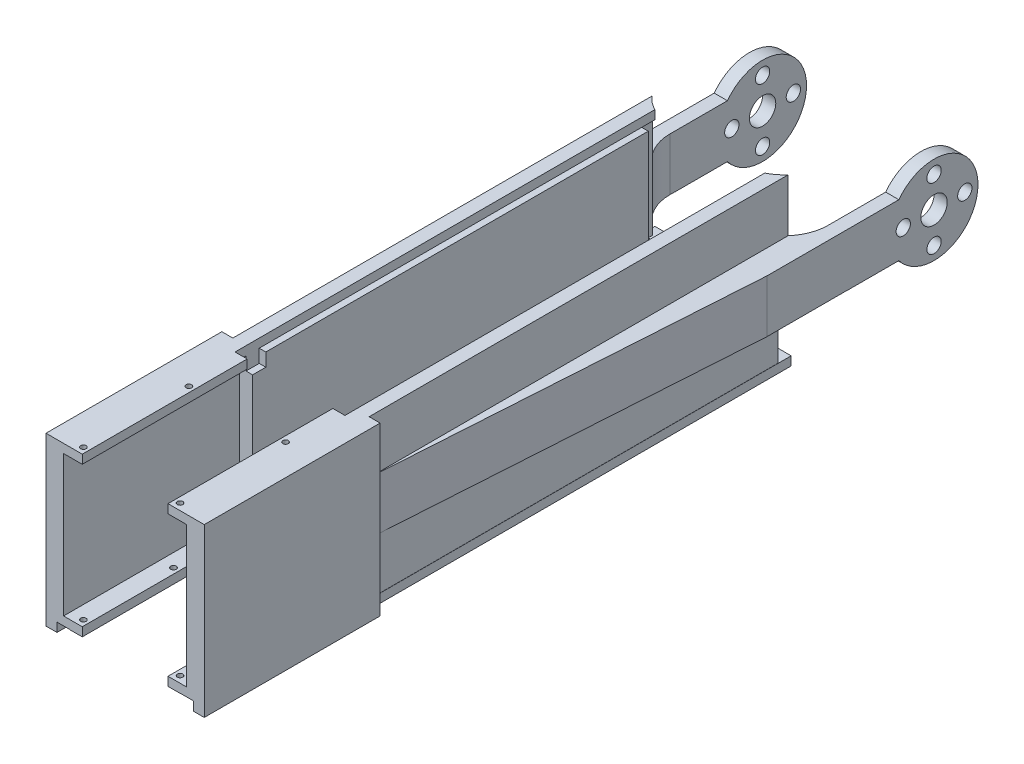
from build123d import *
from build123d.topology import SkipClean

# Parameters (mm, degrees)
BOSS_EXTRUDE1_DEPTH      = 3
SKETCH2_W                = 25
SKETCH2_H                = 2
BOSS_EXTRUDE2_DEPTH      = 130
SKETCH3_R                = 0.625
CUT_EXTRUDE1_DEPTH       = 3
SKETCH4_R                = 0.625
CUT_EXTRUDE2_DEPTH       = 3
SKETCH5_W                = 3
SKETCH5_H                = 25
BOSS_EXTRUDE3_DEPTH      = 40
SKETCH7_W                = 19.5
SKETCH7_H                = 75
CUT_EXTRUDE5_DEPTH       = 40
SKETCH10_W               = 25
SKETCH10_H               = 3
BOSS_EXTRUDE4_DEPTH      = 10
SKETCH11_W               = 25
SKETCH11_H               = 3
BOSS_EXTRUDE5_DEPTH      = 10
SKETCH12_W               = 3
SKETCH12_H               = 25
BOSS_EXTRUDE6_DEPTH      = 10
SKETCH13_W               = 3
SKETCH13_H               = 25
BOSS_EXTRUDE7_DEPTH      = 10
SKETCH14_W               = 133
SKETCH14_H               = 35.95813892
BOSS_EXTRUDE11_DEPTH     = 3
SKETCH15_W               = 133
SKETCH15_H               = 35.95813892
BOSS_EXTRUDE12_DEPTH     = 3
SKETCH16_W               = 23
SKETCH16_H               = 28
CUT_EXTRUDE6_DEPTH       = 13
CUT_EXTRUDE7_DEPTH       = 146.523194028
CUT_EXTRUDE7_DEPTH_BACK  = 146.523194028
SKETCH6_R                = 1.625
SKETCH6_R_2              = 3
FILLET1_R                = 10
FILLET2_R                = 10
SKETCH17_W               = 3
SKETCH17_H               = 2.5
CUT_EXTRUDE8_DEPTH       = 30
SKETCH19_W               = 28
SKETCH19_H               = 32
CUT_EXTRUDE9_DEPTH       = 40
CUT_EXTRUDE11_DEPTH      = 137.54669531
CUT_EXTRUDE11_DEPTH_BACK = 137.54669531
SKETCH20_W               = 25.25
SKETCH20_H               = 11.847644437
SKETCH20_W_2             = 25
SKETCH20_H_2             = 13.837487399
CUT_EXTRUDE12_DEPTH      = 144.934012659
CUT_EXTRUDE12_DEPTH_BACK = 144.934012659
CUT_EXTRUDE13_DEPTH      = 138.746143322
CUT_EXTRUDE13_DEPTH_BACK = 138.746143322
SKETCH22_W               = 10
SKETCH22_H               = 25
CUT_EXTRUDE14_DEPTH      = 10
CUT_EXTRUDE14_DEPTH_BACK = 10
SKETCH24_W               = 5.5
SKETCH24_H               = 6.5
SKETCH24_H_2             = 6.525307194
CUT_EXTRUDE15_DEPTH      = 176.197031938
CUT_EXTRUDE15_DEPTH_BACK = 176.197031938
SKETCH25_W               = 28
SKETCH25_H               = 32
SKETCH31_W               = 25
SKETCH31_H               = 90
CUT_EXTRUDE17_DEPTH      = 5
SKETCH32_W               = 31
SKETCH32_H               = 3
BOSS_EXTRUDE16_DEPTH     = 3
SKETCH33_W               = 5.5
SKETCH33_H               = 11.974692806
SKETCH33_W_2             = 3
SKETCH33_H_2             = 32
BOSS_EXTRUDE17_DEPTH     = 90
CUT_EXTRUDE18_DEPTH      = 137.769879725
CUT_EXTRUDE18_DEPTH_BACK = 137.769879725
FILLET3_START            = -5.974692806
FILLET3_DEPTH            = 11.974692806
FILLET3_START_2          = -10
FILLET3_2_DEPTH          = 28
FILLET3_START_3          = 16
FILLET3_3_DEPTH          = 2
FILLET4_START            = -5.974692806
FILLET4_DEPTH            = 11.974692806
FILLET4_START_2          = -10
FILLET4_2_DEPTH          = 28
FILLET4_START_3          = 16
FILLET4_3_DEPTH          = 2
SKETCH35_W               = 31
SKETCH35_H               = 98.5
BOSS_EXTRUDE18_DEPTH     = 2
SKETCH38_W               = 2.5
SKETCH38_H               = 38
BOSS_EXTRUDE22_DEPTH     = 40
CUT_EXTRUDE19_DEPTH      = 140.907112042
CUT_EXTRUDE19_DEPTH_BACK = 5
SKETCH39_W               = 25
SKETCH39_H               = 5.5


with BuildPart() as part:
    # Sketch1 → Boss-Extrude1 (new body)
    with BuildSketch(Plane.XY):
        Polygon((12.5, 12.5), (21, 12.5), (21, -12.5), (12.5, -12.5), (12.5, -18), (-12.5, -18), (-12.5, -12.5), (-21, -12.5), (-21, 12.5), (-12.5, 12.5), (-12.5, 18), (12.5, 18), align=None)
    extrude(amount=BOSS_EXTRUDE1_DEPTH)

    # Sketch2 → Boss-Extrude2 (add)
    with BuildSketch(Plane.XY.offset(3)):
        with Locations((0, 17)):
            Rectangle(SKETCH2_W, SKETCH2_H)
        with Locations((0, -17)):
            Rectangle(SKETCH2_W, SKETCH2_H)
    extrude(amount=BOSS_EXTRUDE2_DEPTH)

    # Sketch3 → Cut-Extrude1 (cut)
    with BuildSketch(Plane(origin=(0, 18, 0), x_dir=(1, 0, 0), z_dir=(0, 1, 0))):
        with Locations(Location((-11, -107.5, 0), (0, 0, 270))):
            Circle(SKETCH3_R)
        with Locations(Location((11, -107.5, 0), (0, 0, 270))):
            Circle(SKETCH3_R)
        with Locations(Location((-11, -131.5, 0), (0, 0, 270))):
            Circle(SKETCH3_R)
        with Locations(Location((11, -131.5, 0), (0, 0, 270))):
            Circle(SKETCH3_R)
    extrude(amount=-CUT_EXTRUDE1_DEPTH, mode=Mode.SUBTRACT)

    # Sketch4 → Cut-Extrude2 (cut)
    with BuildSketch(Plane(origin=(0, -16, 0), x_dir=(1, 0, 0), z_dir=(0, 1, 0))):
        with Locations(Location((-11, -131.5, 0), (0, 0, 270))):
            Circle(SKETCH4_R)
        with Locations(Location((11, -131.5, 0), (0, 0, 270))):
            Circle(SKETCH4_R)
        with Locations(Location((-11, -111, 0), (0, 0, 270))):
            Circle(SKETCH4_R)
        with Locations(Location((11, -111, 0), (0, 0, 270))):
            Circle(SKETCH4_R)
    extrude(amount=-CUT_EXTRUDE2_DEPTH, mode=Mode.SUBTRACT)

    # Sketch5 → Boss-Extrude3 (add)
    with BuildSketch(Plane(origin=(0, 0, 0), x_dir=(-1, 0, 0), z_dir=(0, 0, -1))):
        with Locations((-19.5, 0)):
            Rectangle(SKETCH5_W, SKETCH5_H)
        with Locations((19.5, 0)):
            Rectangle(SKETCH5_W, SKETCH5_H)
    extrude(amount=BOSS_EXTRUDE3_DEPTH)

    # Sketch7 → Cut-Extrude5 (cut)
    with BuildSketch(Plane(origin=(0, 18, 0), x_dir=(1, 0, 0), z_dir=(0, 1, 0))):
        with Locations((0, -133)):
            Rectangle(SKETCH7_W, SKETCH7_H)
    extrude(amount=-CUT_EXTRUDE5_DEPTH, mode=Mode.SUBTRACT)

    # Sketch10 → Boss-Extrude4 (add)
    with BuildSketch(Plane(origin=(0, 18, 0), x_dir=(1, 0, 0), z_dir=(0, 1, 0))):
        with Locations((0, -1.5)):
            Rectangle(SKETCH10_W, SKETCH10_H)
    extrude(amount=BOSS_EXTRUDE4_DEPTH)

    # Sketch11 → Boss-Extrude5 (add)
    with BuildSketch(Plane.XZ.offset(18)):
        with Locations((0, 1.5)):
            Rectangle(SKETCH11_W, SKETCH11_H)
    extrude(amount=BOSS_EXTRUDE5_DEPTH)

    # Sketch12 → Boss-Extrude6 (add)
    with BuildSketch(Plane.ZY.offset(21)):
        with Locations((1.5, 0)):
            Rectangle(SKETCH12_W, SKETCH12_H)
    extrude(amount=BOSS_EXTRUDE6_DEPTH)

    # Sketch13 → Boss-Extrude7 (add)
    with BuildSketch(Plane(origin=(21, 0, 0), x_dir=(0, 0, -1), z_dir=(1, 0, 0))):
        with Locations((-1.5, 0)):
            Rectangle(SKETCH13_W, SKETCH13_H)
    extrude(amount=BOSS_EXTRUDE7_DEPTH)

    # Sketch14 → Boss-Extrude11 (add)
    with BuildSketch(Plane.ZY.offset(12.5)):
        with Locations((66.5, 0.02093054)):
            Rectangle(SKETCH14_W, SKETCH14_H)
    extrude(amount=BOSS_EXTRUDE11_DEPTH)

    # Sketch15 → Boss-Extrude12 (add)
    with BuildSketch(Plane(origin=(12.5, 0, 0), x_dir=(0, 0, -1), z_dir=(1, 0, 0))):
        with Locations((-66.5, 0.02093054)):
            Rectangle(SKETCH15_W, SKETCH15_H)
    extrude(amount=BOSS_EXTRUDE12_DEPTH)

    # Sketch16 → Cut-Extrude6 (cut)
    with BuildSketch(Plane(origin=(0, 0, 0), x_dir=(-1, 0, 0), z_dir=(0, 0, -1))):
        Rectangle(SKETCH16_W, SKETCH16_H)
    extrude(amount=-CUT_EXTRUDE6_DEPTH, mode=Mode.SUBTRACT)

    # Sketch6 → Cut-Extrude7 (cut, two sides: drawn at the far end of the back side and taken through both)
    with BuildSketch(Plane(origin=(21, 0, 0), x_dir=(0, 0, -1), z_dir=(1, 0, 0)).offset(-CUT_EXTRUDE7_DEPTH_BACK)):
        with Locations(Location((30, 7, 0), (0, 0, 90))):
            Circle(SKETCH6_R)
        with Locations(Location((30, 0, 0), (0, 0, 90))):
            Circle(SKETCH6_R_2)
        with Locations(Location((37, 0, 0), (0, 0, 90))):
            Circle(SKETCH6_R)
        with Locations(Location((30, -7, 0), (0, 0, 90))):
            Circle(SKETCH6_R)
        with Locations(Location((23, 0, 0), (0, 0, 90))):
            Circle(SKETCH6_R)
        with BuildLine():
            Line((30, 10), (30, 12.5))
            Line((30, 12.5), (46.457343261, 12.5))
            Line((46.457343261, 12.5), (46.457343261, -12.5))
            Line((46.457343261, -12.5), (30, -12.5))
            Line((30, -12.5), (30, -10))
            ThreePointArc((30, -10), (40, 0), (30, 10))
        make_face()
    extrude(amount=CUT_EXTRUDE7_DEPTH + CUT_EXTRUDE7_DEPTH_BACK, mode=Mode.SUBTRACT)

    # Fillet1
    fillet1_edges = [part.edges().sort_by_distance(p)[0] for p in [
        (31, 12.5, 1.5),
    ]]
    fillet(fillet1_edges, radius=FILLET1_R)

    # Fillet2
    fillet2_edges = [part.edges().sort_by_distance(p)[0] for p in [
        (12.5, 28, 1.5),
        (-12.5, 28, 1.5),
        (-31, 12.5, 1.5),
        (12.5, -28, 1.5),
        (-31, -12.5, 1.5),
        (-12.5, -28, 1.5),
        (31, -12.5, 1.5),
    ]]
    fillet(fillet2_edges, radius=FILLET2_R - 0.0001)  # a hair under: the kernel refuses the full size

    # Sketch17 → Cut-Extrude8 (cut)
    with BuildSketch(Plane(origin=(0, 0, -30), x_dir=(-1, 0, 0), z_dir=(0, 0, -1))):
        with Locations((-19.5, 11.25)):
            Rectangle(SKETCH17_W, SKETCH17_H)
        with Locations((-19.5, -11.25)):
            Rectangle(SKETCH17_W, SKETCH17_H)
        with Locations((19.5, 11.25)):
            Rectangle(SKETCH17_W, SKETCH17_H)
        with Locations((19.5, -11.25)):
            Rectangle(SKETCH17_W, SKETCH17_H)
    extrude(amount=-CUT_EXTRUDE8_DEPTH, mode=Mode.SUBTRACT)

    # Sketch19 → Cut-Extrude9 (cut)
    with BuildSketch(Plane.XY.offset(133)):
        Rectangle(SKETCH19_W, SKETCH19_H)
    extrude(amount=-CUT_EXTRUDE9_DEPTH, mode=Mode.SUBTRACT)

    # Sketch20 → Cut-Extrude11 (cut, two sides: drawn at the far end of the back side and taken through both)
    with BuildSketch(Plane.XY.offset(3).offset(-CUT_EXTRUDE11_DEPTH_BACK)):
        with Locations((0, 23.923822218)):
            Rectangle(SKETCH20_W, SKETCH20_H)
        with Locations((0, -24.918743699)):
            Rectangle(SKETCH20_W_2, SKETCH20_H_2)
    extrude(amount=CUT_EXTRUDE11_DEPTH + CUT_EXTRUDE11_DEPTH_BACK, mode=Mode.SUBTRACT)

    # Sketch21 → Cut-Extrude12 (cut, two sides: drawn at the far end of the back side and taken through both)
    with SkipClean():  # the faces are left unmerged after this step: merging them gives an invalid solid
        with BuildSketch(Plane.ZY.offset(21).offset(-CUT_EXTRUDE12_DEPTH_BACK)):
            with BuildLine():
                Line((-30, 10), (0, 10))
                Line((0, 10), (0, 6))
                Line((0, 6), (-22, 6))
                ThreePointArc((-22, 6), (-25.527864045, 8.94427191), (-30, 10))
            make_face()
            with BuildLine():
                Line((-22, -6), (0, -6))
                Line((0, -6), (0, -10))
                Line((0, -10), (-30, -10))
                ThreePointArc((-30, -10), (-25.527864045, -8.94427191), (-22, -6))
            make_face()
        extrude(amount=CUT_EXTRUDE12_DEPTH + CUT_EXTRUDE12_DEPTH_BACK, mode=Mode.SUBTRACT)

    # Sketch22 → Cut-Extrude13 (cut, two sides: drawn at the far end of the back side and taken through both)
    with SkipClean():  # the faces are left unmerged after this step: merging them gives an invalid solid
        with BuildSketch(Plane(origin=(0, 0, 0), x_dir=(-1, 0, 0), z_dir=(0, 0, -1)).offset(-CUT_EXTRUDE13_DEPTH_BACK)):
            with Locations((26, 0)):
                Rectangle(SKETCH22_W, SKETCH22_H)
            with Locations((-26, 0)):
                Rectangle(SKETCH22_W, SKETCH22_H)
        extrude(amount=CUT_EXTRUDE13_DEPTH + CUT_EXTRUDE13_DEPTH_BACK, mode=Mode.SUBTRACT)

    # Sketch24 → Cut-Extrude14 (cut, two sides: drawn at the far end of the back side and taken through both)
    with SkipClean():  # the faces are left unmerged after this step: merging them gives an invalid solid
        with BuildSketch(Plane(origin=(0, 0, 0), x_dir=(-1, 0, 0), z_dir=(0, 0, -1)).offset(-CUT_EXTRUDE14_DEPTH_BACK)):
            with Locations((18.25, 9.25)):
                Rectangle(SKETCH24_W, SKETCH24_H)
            with Locations((18.25, -9.237346403)):
                Rectangle(SKETCH24_W, SKETCH24_H_2)
            with Locations((-18.25, -9.237346403)):
                Rectangle(SKETCH24_W, SKETCH24_H_2)
            with Locations((-18.25, 9.25)):
                Rectangle(SKETCH24_W, SKETCH24_H)
        extrude(amount=CUT_EXTRUDE14_DEPTH + CUT_EXTRUDE14_DEPTH_BACK, mode=Mode.SUBTRACT)

    # Sketch25 → Cut-Extrude15 (cut, two sides: drawn at the far end of the back side and taken through both)
    with SkipClean():  # the faces are left unmerged after this step: merging them gives an invalid solid
        with BuildSketch(Plane.XY.offset(133).offset(-CUT_EXTRUDE15_DEPTH_BACK)):
            Rectangle(SKETCH25_W, SKETCH25_H)
        extrude(amount=CUT_EXTRUDE15_DEPTH + CUT_EXTRUDE15_DEPTH_BACK, mode=Mode.SUBTRACT)

    # Sketch31 → Cut-Extrude17 (cut)
    with SkipClean():  # the faces are left unmerged after this step: merging them gives an invalid solid
        with BuildSketch(Plane(origin=(0, 18, 0), x_dir=(1, 0, 0), z_dir=(0, 1, 0))):
            with Locations((0, -45)):
                Rectangle(SKETCH31_W, SKETCH31_H)
        extrude(amount=-CUT_EXTRUDE17_DEPTH, mode=Mode.SUBTRACT)

    # Sketch32 → Boss-Extrude16 (add)
    with SkipClean():  # the faces are left unmerged after this step: merging them gives an invalid solid
        with BuildSketch(Plane(origin=(0, 0, 0), x_dir=(-1, 0, 0), z_dir=(0, 0, -1))):
            with Locations((0, -9.5)):
                Rectangle(SKETCH32_W, SKETCH32_H)
        extrude(amount=BOSS_EXTRUDE16_DEPTH)

    # Sketch33 → Boss-Extrude17 (add)
    with SkipClean():  # the faces are left unmerged after this step: merging them gives an invalid solid
        with BuildSketch(Plane.XY.offset(3)):
            with Locations((18.25, 0.012653597)):
                Rectangle(SKETCH33_W, SKETCH33_H)
            with Locations((-18.25, 0.012653597)):
                Rectangle(SKETCH33_W, SKETCH33_H)
            with Locations((-12.5, 0)):
                Rectangle(SKETCH33_W_2, SKETCH33_H_2)
            with Locations((12.5, 0)):
                Rectangle(SKETCH33_W_2, SKETCH33_H_2)
        extrude(amount=BOSS_EXTRUDE17_DEPTH)

    # Sketch34 → Cut-Extrude18 (cut, two sides: drawn at the far end of the back side and taken through both)
    with SkipClean():  # the faces are left unmerged after this step: merging them gives an invalid solid
        with BuildSketch(Plane(origin=(0, 6, 0), x_dir=(1, 0, 0), z_dir=(0, 1, 0)).offset(-CUT_EXTRUDE18_DEPTH_BACK)):
            Polygon((15.5, -93), (21, -8), (21, -93), align=None)
            Polygon((-15.5, -93), (-21, -93), (-21, -8), align=None)
        extrude(amount=CUT_EXTRUDE18_DEPTH + CUT_EXTRUDE18_DEPTH_BACK, mode=Mode.SUBTRACT)

    # Fillet3: read off the stored shape, not the designer's step
    # Fillet3 outline → Fillet3 (add)
    with SkipClean():  # the faces are left unmerged after this step: merging them gives an invalid solid
        with BuildSketch(Plane(origin=(0, 0, 0), x_dir=(1, 0, 0), z_dir=(0, 1, 0)).offset(FILLET3_START)):
            with BuildLine():
                Line((-14, 0), (-14, 0.93028555))
                ThreePointArc((-14, 0.93028555), (-16.94427191, 4.458149595), (-18, 8.93028555))
                Line((-18, 8.93028555), (-18, 0))
                Line((-18, 0), (-14, 0))
            make_face()
        extrude(amount=FILLET3_DEPTH)

    # Fillet3 2 outline → Fillet3 2 (add)
    with SkipClean():  # the faces are left unmerged after this step: merging them gives an invalid solid
        with BuildSketch(Plane(origin=(0, 0, 0), x_dir=(1, 0, 0), z_dir=(0, 1, 0)).offset(FILLET3_START_2)):
            with BuildLine():
                Line((-14, 0), (-14, 0.93028555))
                ThreePointArc((-14, 0.93028555), (-14.785461435, 1.584707757), (-15.5, 2.315907272))
                Line((-15.5, 2.315907272), (-15.5, 0))
                Line((-15.5, 0), (-14, 0))
            make_face()
        extrude(amount=FILLET3_2_DEPTH)

    # Fillet3 3 outline → Fillet3 3 (add)
    with SkipClean():  # the faces are left unmerged after this step: merging them gives an invalid solid
        with BuildSketch(Plane(origin=(0, 0, 0), x_dir=(1, 0, 0), z_dir=(0, 1, 0)).offset(FILLET3_START_3)):
            with BuildLine():
                ThreePointArc((-12.5, 0), (-13.270565226, 0.431983237), (-14, 0.93028555))
                Line((-14, 0.93028555), (-14, 0))
                Line((-14, 0), (-12.5, 0))
            make_face()
        extrude(amount=FILLET3_3_DEPTH)

    # Fillet4: read off the stored shape, not the designer's step
    # Fillet4 outline → Fillet4 (add)
    with SkipClean():  # the faces are left unmerged after this step: merging them gives an invalid solid
        with BuildSketch(Plane(origin=(0, 0, 0), x_dir=(1, 0, 0), z_dir=(0, 1, 0)).offset(FILLET4_START)):
            with BuildLine():
                Line((14, 0.93028555), (14, 0))
                Line((14, 0), (18, 0))
                Line((18, 0), (18, 8.93028555))
                ThreePointArc((18, 8.93028555), (16.94427191, 4.458149595), (14, 0.93028555))
            make_face()
        extrude(amount=FILLET4_DEPTH)

    # Fillet4 2 outline → Fillet4 2 (add)
    with SkipClean():  # the faces are left unmerged after this step: merging them gives an invalid solid
        with BuildSketch(Plane(origin=(0, 0, 0), x_dir=(1, 0, 0), z_dir=(0, 1, 0)).offset(FILLET4_START_2)):
            with BuildLine():
                Line((14, 0.93028555), (14, 0))
                Line((14, 0), (15.5, 0))
                Line((15.5, 0), (15.5, 2.315907272))
                ThreePointArc((15.5, 2.315907272), (14.785461435, 1.584707757), (14, 0.93028555))
            make_face()
        extrude(amount=FILLET4_2_DEPTH)

    # Fillet4 3 outline → Fillet4 3 (add)
    with SkipClean():  # the faces are left unmerged after this step: merging them gives an invalid solid
        with BuildSketch(Plane(origin=(0, 0, 0), x_dir=(1, 0, 0), z_dir=(0, 1, 0)).offset(FILLET4_START_3)):
            with BuildLine():
                Line((12.5, 0), (14, 0))
                Line((14, 0), (14, 0.93028555))
                ThreePointArc((14, 0.93028555), (13.270565226, 0.431983237), (12.5, 0))
            make_face()
        extrude(amount=FILLET4_3_DEPTH)

    # Sketch35 → Boss-Extrude18 (add)
    with SkipClean():  # the faces are left unmerged after this step: merging them gives an invalid solid
        with BuildSketch(Plane.XZ.offset(18)):
            with Locations((0, 46.25)):
                Rectangle(SKETCH35_W, SKETCH35_H)
        extrude(amount=BOSS_EXTRUDE18_DEPTH)

    # Sketch38 → Boss-Extrude22 (add)
    with SkipClean():  # the faces are left unmerged after this step: merging them gives an invalid solid
        with BuildSketch(Plane.XY.offset(133)):
            with Locations((16.75, -1)):
                Rectangle(SKETCH38_W, SKETCH38_H)
            with Locations((-16.75, -1)):
                Rectangle(SKETCH38_W, SKETCH38_H)
        extrude(amount=-BOSS_EXTRUDE22_DEPTH)

    # Sketch39 → Cut-Extrude19 (cut, two sides: drawn at the far end of the back side and taken through both)
    with SkipClean():  # the faces are left unmerged after this step: merging them gives an invalid solid
        with BuildSketch(Plane(origin=(0, 18, 0), x_dir=(1, 0, 0), z_dir=(0, 1, 0)).offset(-CUT_EXTRUDE19_DEPTH_BACK)):
            with Locations((0, -92.75)):
                Rectangle(SKETCH39_W, SKETCH39_H)
        extrude(amount=CUT_EXTRUDE19_DEPTH + CUT_EXTRUDE19_DEPTH_BACK, mode=Mode.SUBTRACT)


solid = part.part
